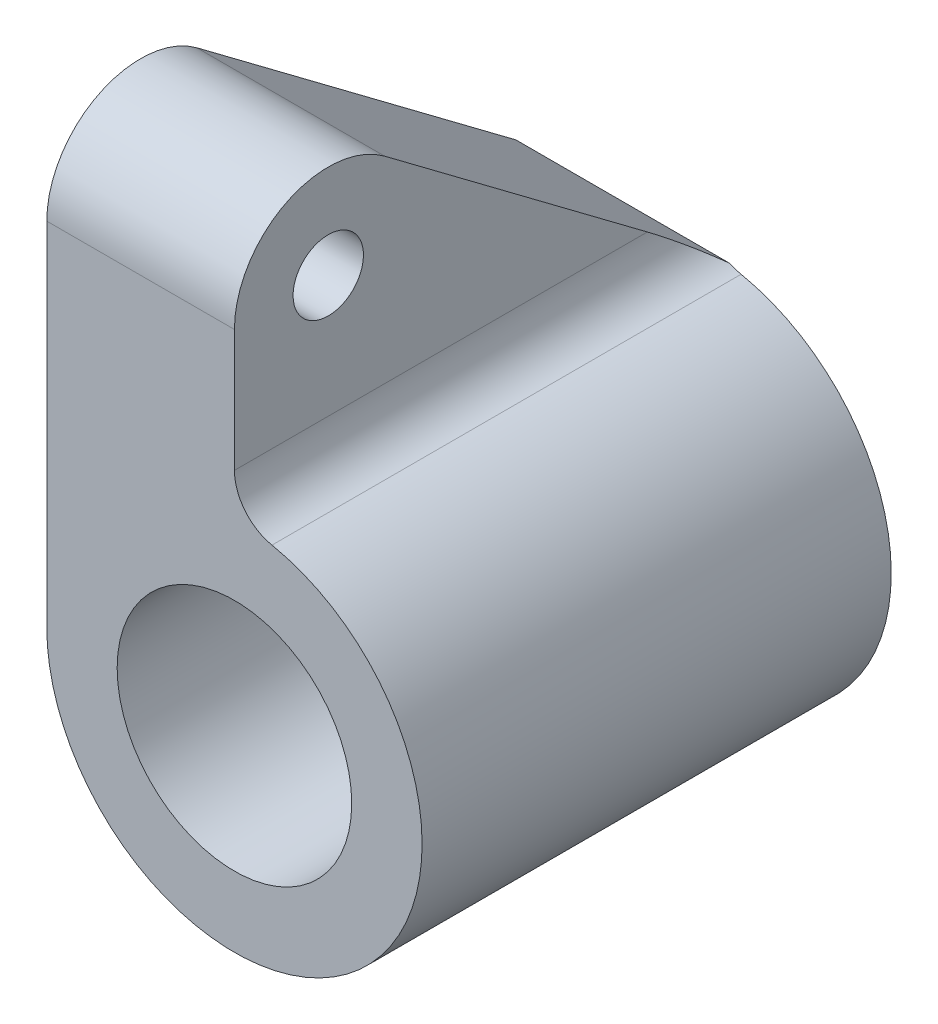
from build123d import *

# Parameters (mm, degrees)
SKETCH_1_R          = 8
SKETCH_1_R_2        = 5
EXTRUDE_1_DEPTH     = 20
EXTRUDE_2_DEPTH     = 20
SKETCH_3_R          = 1.5
CUT_EXTRUDE_1_DEPTH = 33.496153619
FILLET_1_R          = 2


with BuildPart() as part:
    # 草图1 → 凸台-拉伸1 (new body)
    with BuildSketch(Plane.XY):
        Circle(SKETCH_1_R)
        Circle(SKETCH_1_R_2, mode=Mode.SUBTRACT)
    extrude(amount=EXTRUDE_1_DEPTH)

    # 草图2 → 凸台-拉伸2 (add, through all)
    with BuildSketch(Plane.XY.offset(20)):
        with BuildLine():
            Line((-8, 0), (-8, 20))
            Line((-8, 20), (0, 20))
            Line((0, 20), (0, 8))
            ThreePointArc((0, 8), (-5.656854249, 5.656854249), (-8, 0))
        make_face()
    extrude(amount=-EXTRUDE_2_DEPTH)

    # 草图3 → 切除-拉伸1 (cut, through all)
    with BuildSketch(Plane.ZY.offset(8)):
        with Locations((16, 15)):
            Circle(SKETCH_3_R)
        with BuildLine():
            Line((13.6, 18.2), (0, 8))
            Line((0, 8), (0, 20))
            Line((0, 20), (20, 20))
            Line((20, 20), (20, 15))
            ThreePointArc((20, 15), (17.788854382, 18.577708764), (13.6, 18.2))
        make_face()
    extrude(amount=-CUT_EXTRUDE_1_DEPTH, mode=Mode.SUBTRACT)

    # 圆角1
    # the kernel refuses this fillet: 2 mm, written as the material it adds along each edge
    with BuildSketch(Plane(origin=(0, 8, 20), x_dir=(0.994936153005124, -0.10050896200520786, 0), z_dir=(0, 0, -1))) as fillet_1_piece_1_section:
        with BuildLine():
            CenterArc((1.809161316, -1.989872306), FILLET_1_R, 95.768479516, 78.463040967)
            Line((-0.18071099, -1.788854382), (0, 0))
            ThreePointArc((0, 0), (0.804071696, -0.040510776), (1.608143392, 0))
        make_face()
    fillet_1_piece_1 = extrude(amount=20, mode=Mode.PRIVATE)
    fillet_1_piece_1 = split(fillet_1_piece_1, bisect_by=Plane(origin=(0.363016692, 13.065708847, 6.754278462), z_dir=(0, -0.8000000000000002, 0.5999999999999999)), keep=Keep.TOP, mode=Mode.PRIVATE)
    add(fillet_1_piece_1)


solid = part.part
